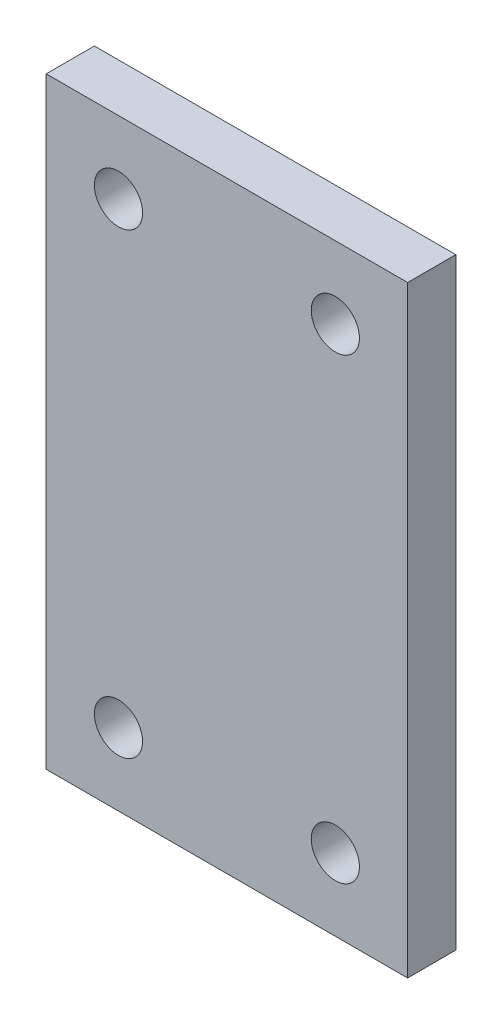
from build123d import *

# Parameters (mm, degrees)
SKETCH1_W           = 38.1
SKETCH1_H           = 63.5
SKETCH1_R           = 2.54
BOSS_EXTRUDE1_DEPTH = 5.08


with BuildPart() as part:
    # Sketch1 → Boss-Extrude1 (new body)
    with BuildSketch(Plane.XY):
        with Locations((-29.594105975, 62.392212855)):
            Rectangle(SKETCH1_W, SKETCH1_H)
        with Locations((-41.024105975, 38.262212855)):
            Circle(SKETCH1_R, mode=Mode.SUBTRACT)
        with Locations((-18.164105975, 38.262212855)):
            Circle(SKETCH1_R, mode=Mode.SUBTRACT)
        with Locations((-18.164105975, 86.522212855)):
            Circle(SKETCH1_R, mode=Mode.SUBTRACT)
        with Locations((-41.024105975, 86.522212855)):
            Circle(SKETCH1_R, mode=Mode.SUBTRACT)
    extrude(amount=BOSS_EXTRUDE1_DEPTH)


solid = part.part
